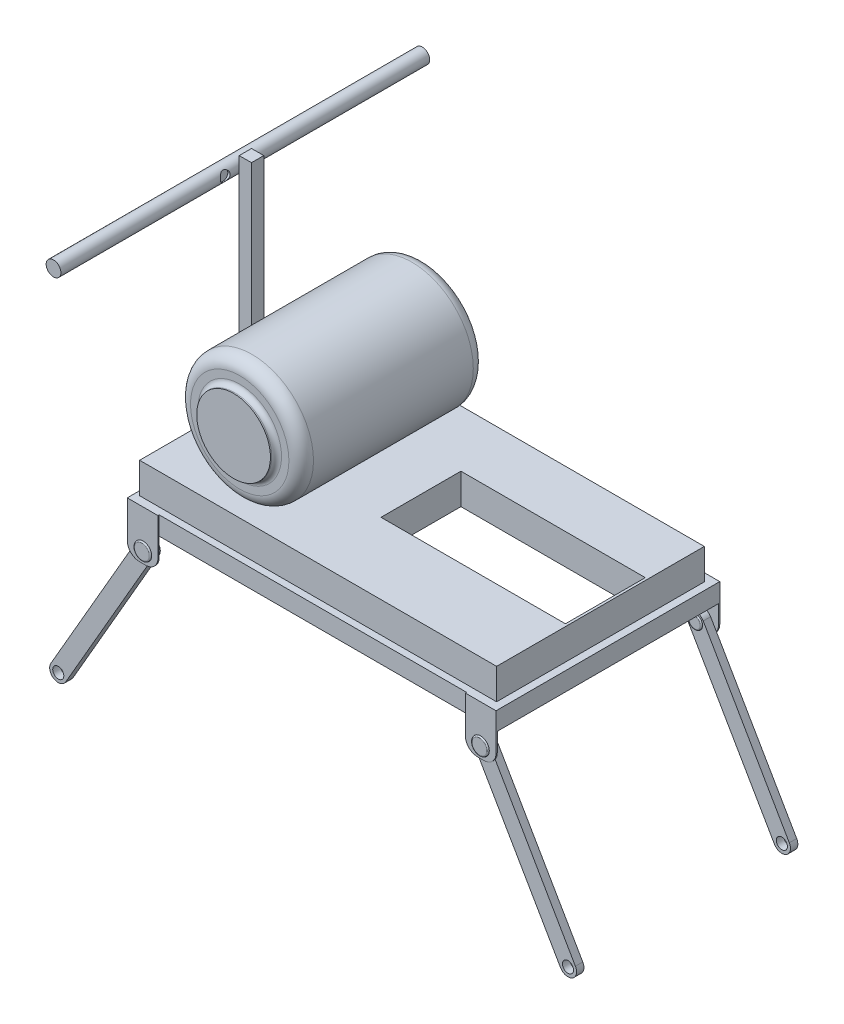
from build123d import *

# Parameters (mm, degrees)
SKETCH1_W                 = 300
SKETCH1_H                 = 15
BOSS_EXTRUDE1_DEPTH       = 180
SKETCH2_W                 = 276.393153848
SKETCH2_H                 = 159.056437592
CUT_EXTRUDE1_DEPTH        = 180
SKETCH3_W                 = 288.387573732
SKETCH3_H                 = 168.964871408
BOSS_EXTRUDE2_DEPTH       = 25
BOSS_EXTRUDE3_DEPTH       = 1
BOSS_EXTRUDE4_START       = 1
BOSS_EXTRUDE4_DEPTH       = 1
SKETCH6_R                 = 5
CUT_EXTRUDE2_DEPTH        = 200
SKETCH7_R                 = 4.8
SKETCH7_R_2               = 4.5
BOSS_EXTRUDE5_DEPTH       = 6
BOSS_EXTRUDE6_START       = 6
SKETCH8_R                 = 4.5
BOSS_EXTRUDE6_DEPTH       = 6
BOSS_EXTRUDE13_START      = 1
SKETCH15_R                = 7
BOSS_EXTRUDE13_DEPTH      = 1
FILLET2_R                 = 1
FILLET3_R                 = 1
SKETCH16_R                = 7.5
BOSS_EXTRUDE14_DEPTH      = 1
FILLET4_R                 = 1
SKETCH17_R                = 5.5
BOSS_EXTRUDE15_DEPTH      = 1
FILLET5_R                 = 1
BOSS_EXTRUDE16_START      = 1
SKETCH18_R                = 5.5
BOSS_EXTRUDE16_DEPTH      = 1
FILLET6_R                 = 1
SKETCH25_W                = 168.964871408
SKETCH25_H                = 25
BOSS_EXTRUDE22_DEPTH      = 2
SKETCH28_W                = 10
SKETCH28_H                = 10
BOSS_EXTRUDE25_DEPTH      = 175
BOSS_EXTRUDE26_DEPTH      = 145
BOSS_EXTRUDE26_DEPTH_BACK = 155
SKETCH30_R                = 6
SKETCH31_R                = 2
CUT_EXTRUDE3_DEPTH        = 15
SKETCH32_R                = 4
CUT_EXTRUDE4_DEPTH        = 2
SKETCH33_W                = 17.452069939
SKETCH33_H                = 31.073197695
BOSS_EXTRUDE27_DEPTH      = 15
FILLET7_R                 = 5
EXTRUDE_THIN3_DEPTH       = 5
EXTRUDE_THIN3_DEPTH_BACK  = 35
SKETCH34_R                = 2
SKETCH34_R_2              = 1.5
SKETCH35_W                = 2.832524323
SKETCH35_H                = 4.052008071
SKETCH35_R                = 0.8
SKETCH35_W_2              = 2.769934418
BOSS_EXTRUDE28_DEPTH      = 0.5
SKETCH36_R                = 1.5
BOSS_EXTRUDE29_DEPTH      = 14
SKETCH38_R                = 50
BOSS_EXTRUDE31_DEPTH      = 150
SKETCH39_R                = 30
BOSS_EXTRUDE32_DEPTH      = 5
BOSS_EXTRUDE33_START      = 5
SKETCH40_R                = 30
BOSS_EXTRUDE33_DEPTH      = 5
FILLET8_R                 = 10
FILLET9_R                 = 4
SKETCH41_W                = 150
SKETCH41_H                = 65
CUT_EXTRUDE5_DEPTH        = 40


with BuildPart() as part:
    # Sketch1 → Boss-Extrude1 (new body)
    with BuildSketch(Plane.XY):
        with Locations((48.043406306, 18.498679245)):
            Rectangle(SKETCH1_W, SKETCH1_H)
    extrude(amount=-BOSS_EXTRUDE1_DEPTH)

    # Sketch2 → Cut-Extrude1 (cut)
    with BuildSketch(Plane(origin=(0, 25.998679245, 0), x_dir=(1, 0, 0), z_dir=(0, 1, 0))):
        with Locations((47.521909789, 90.260748258)):
            Rectangle(SKETCH2_W, SKETCH2_H)
    extrude(amount=-CUT_EXTRUDE1_DEPTH, mode=Mode.SUBTRACT)

    # Sketch3 → Boss-Extrude2 (add)
    with BuildSketch(Plane(origin=(0, 25.998679245, 0), x_dir=(1, 0, 0), z_dir=(0, 1, 0))):
        with Locations((47.782658048, 90)):
            Rectangle(SKETCH3_W, SKETCH3_H)
    extrude(amount=BOSS_EXTRUDE2_DEPTH)

    # Sketch4 → Boss-Extrude3 (add)
    with BuildSketch(Plane.XY):
        with BuildLine():
            Line((173.043406306, 25.998679245), (173.043406306, -4.001320755))
            ThreePointArc((173.043406306, -4.001320755), (175.972338494, -11.072388567), (183.043406306, -14.001320755))
            Line((183.043406306, -14.001320755), (188.043406306, -14.001320755))
            ThreePointArc((188.043406306, -14.001320755), (195.114474118, -11.072388567), (198.043406306, -4.001320755))
            Line((198.043406306, -4.001320755), (198.043406306, 25.998679245))
            Line((198.043406306, 25.998679245), (173.043406306, 25.998679245))
        make_face()
        with BuildLine():
            Line((-101.956593694, 25.998679245), (-76.956593694, 25.998679245))
            Line((-76.956593694, 25.998679245), (-76.956593694, -4.001320755))
            ThreePointArc((-76.956593694, -4.001320755), (-79.885525882, -11.072388567), (-86.956593694, -14.001320755))
            Line((-86.956593694, -14.001320755), (-91.956593694, -14.001320755))
            ThreePointArc((-91.956593694, -14.001320755), (-99.027661506, -11.072388567), (-101.956593694, -4.001320755))
            Line((-101.956593694, -4.001320755), (-101.956593694, 25.998679245))
        make_face()
    extrude(amount=BOSS_EXTRUDE3_DEPTH)

    # Sketch5 → Boss-Extrude4 (add)
    with BuildSketch(Plane(origin=(0, 0, -180), x_dir=(-1, 0, 0), z_dir=(0, 0, -1)).offset(BOSS_EXTRUDE4_START)):
        with BuildLine():
            Line((-173.043406306, 25.998679245), (-173.043406306, -4.001320755))
            ThreePointArc((-173.043406306, -4.001320755), (-175.972338494, -11.072388567), (-183.043406306, -14.001320755))
            Line((-183.043406306, -14.001320755), (-188.043406306, -14.001320755))
            ThreePointArc((-188.043406306, -14.001320755), (-195.114474118, -11.072388567), (-198.043406306, -4.001320755))
            Line((-198.043406306, -4.001320755), (-198.043406306, 25.998679245))
            Line((-198.043406306, 25.998679245), (-173.043406306, 25.998679245))
        make_face()
        with BuildLine():
            Line((76.576694111, 26.008778741), (101.576694111, 26.008778741))
            Line((101.576694111, 26.008778741), (101.576694111, -3.991221259))
            ThreePointArc((101.576694111, -3.991221259), (98.647761923, -11.062289071), (91.576694111, -13.991221259))
            Line((91.576694111, -13.991221259), (86.576694111, -13.991221259))
            ThreePointArc((86.576694111, -13.991221259), (79.5056263, -11.062289071), (76.576694111, -3.991221259))
            Line((76.576694111, -3.991221259), (76.576694111, 26.008778741))
        make_face()
    extrude(amount=-BOSS_EXTRUDE4_DEPTH)

    # Sketch6 → Cut-Extrude2 (cut)
    with BuildSketch(Plane.XY.offset(1)):
        with Locations(Location((-89.076694111, -4.970985928, 0), (0, 0, 180))):
            Circle(SKETCH6_R)
        with Locations((185.543406306, -4.970985928)):
            Circle(SKETCH6_R)
    extrude(amount=-CUT_EXTRUDE2_DEPTH, mode=Mode.SUBTRACT)

    # Sketch7 → Boss-Extrude5 (add)
    # profile 1 of 2: a face of its own
    with BuildSketch(Plane(origin=(0, 0, 0), x_dir=(-1, 0, 0), z_dir=(0, 0, -1))):
        with BuildLine():
            Line((-179.48122848, -8.470985928), (-249.48122848, -129.714542458))
            ThreePointArc((-249.48122848, -129.714542458), (-259.043406306, -132.276720284), (-261.605584133, -122.714542458))
            Line((-261.605584133, -122.714542458), (-191.605584133, -1.470985928))
            ThreePointArc((-191.605584133, -1.470985928), (-182.043406306, 1.091191899), (-179.48122848, -8.470985928))
        make_face()
        with Locations((-185.543406306, -4.970985928)):
            Circle(SKETCH7_R, mode=Mode.SUBTRACT)
        with Locations((-255.543406306, -126.214542458)):
            Circle(SKETCH7_R_2, mode=Mode.SUBTRACT)
    # profile 2 of 2: a face of its own
    with BuildSketch(Plane(origin=(0, 0, 0), x_dir=(-1, 0, 0), z_dir=(0, 0, -1))):
        with BuildLine():
            Line((95.138871938, -1.470985928), (165.138871938, -122.714542458))
            ThreePointArc((165.138871938, -122.714542458), (162.576694111, -132.276720284), (153.014516285, -129.714542458))
            Line((153.014516285, -129.714542458), (83.014516285, -8.470985928))
            ThreePointArc((83.014516285, -8.470985928), (85.576694111, 1.091191899), (95.138871938, -1.470985928))
        make_face()
        with Locations((89.076694111, -4.970985928)):
            Circle(SKETCH7_R_2, mode=Mode.SUBTRACT)
        with Locations((159.076694111, -126.214542458)):
            Circle(SKETCH7_R_2, mode=Mode.SUBTRACT)
    extrude(amount=BOSS_EXTRUDE5_DEPTH)

    # Sketch8 → Boss-Extrude6 (add)
    # profile 1 of 2: a face of its own
    with BuildSketch(Plane.XY.offset(-180).offset(BOSS_EXTRUDE6_START)):
        with BuildLine():
            Line((-83.014516285, -8.470985928), (-153.014516285, -129.714542458))
            ThreePointArc((-153.014516285, -129.714542458), (-162.576694111, -132.276720284), (-165.138871938, -122.714542458))
            Line((-165.138871938, -122.714542458), (-95.138871938, -1.470985928))
            ThreePointArc((-95.138871938, -1.470985928), (-85.576694111, 1.091191899), (-83.014516285, -8.470985928))
        make_face()
        with Locations(Location((-89.076694111, -4.970985928, 0), (0, 0, 180))):
            Circle(SKETCH8_R, mode=Mode.SUBTRACT)
        with Locations(Location((-159.076694111, -126.214542458, 0), (0, 0, 180))):
            Circle(SKETCH8_R, mode=Mode.SUBTRACT)
    # profile 2 of 2: a face of its own
    with BuildSketch(Plane.XY.offset(-180).offset(BOSS_EXTRUDE6_START)):
        with BuildLine():
            Line((191.605584133, -1.470985928), (261.605584133, -122.714542458))
            ThreePointArc((261.605584133, -122.714542458), (259.043406306, -132.276720284), (249.48122848, -129.714542458))
            Line((249.48122848, -129.714542458), (179.48122848, -8.470985928))
            ThreePointArc((179.48122848, -8.470985928), (182.043406306, 1.091191899), (191.605584133, -1.470985928))
        make_face()
        with Locations((185.543406306, -4.970985928)):
            Circle(SKETCH8_R, mode=Mode.SUBTRACT)
        with Locations(Location((255.543406306, -126.214542458, 0), (0, 0, 180))):
            Circle(SKETCH8_R, mode=Mode.SUBTRACT)
    extrude(amount=-BOSS_EXTRUDE6_DEPTH)

    # Sketch15 → Boss-Extrude13 (add)
    with BuildSketch(Plane.XY.offset(1).offset(BOSS_EXTRUDE13_START)):
        with Locations(Location((185.543406306, -4.970985928, 0), (0, 0, 180))):
            Circle(SKETCH15_R)
        with Locations(Location((-89.076694111, -4.970985928, 0), (0, 0, 180))):
            Circle(SKETCH15_R)
    extrude(amount=-BOSS_EXTRUDE13_DEPTH)

    # Fillet2
    fillet2_edges = [part.edges().sort_by_distance(p)[0] for p in [
        (-82.076694111, -4.970985928, 2),
    ]]
    fillet(fillet2_edges, radius=FILLET2_R - 0.0001)  # a hair under: the kernel refuses the full size

    # Fillet3
    fillet3_edges = [part.edges().sort_by_distance(p)[0] for p in [
        (192.543406306, -4.970985928, 2),
    ]]
    fillet(fillet3_edges, radius=FILLET3_R - 0.0001)  # a hair under: the kernel refuses the full size

    # Sketch16 → Boss-Extrude14 (add)
    with BuildSketch(Plane(origin=(0, 0, -181), x_dir=(-1, 0, 0), z_dir=(0, 0, -1))):
        with Locations(Location((-185.543406306, -4.970985928, 0), (0, 0, 180))):
            Circle(SKETCH16_R)
        with Locations((89.076694111, -4.970985928)):
            Circle(SKETCH16_R)
    extrude(amount=BOSS_EXTRUDE14_DEPTH)

    # Fillet4
    fillet4_edges = [part.edges().sort_by_distance(p)[0] for p in [
        (178.043406306, -4.970985928, -182),
        (-81.576694111, -4.970985928, -182),
    ]]
    fillet(fillet4_edges, radius=FILLET4_R - 0.0001)  # a hair under: the kernel refuses the full size

    # Sketch17 → Boss-Extrude15 (add)
    with BuildSketch(Plane(origin=(0, 0, -6), x_dir=(-1, 0, 0), z_dir=(0, 0, -1))):
        with Locations((89.076694111, -4.970985928)):
            Circle(SKETCH17_R)
        with Locations((-185.543406306, -4.970985928)):
            Circle(SKETCH17_R)
    extrude(amount=BOSS_EXTRUDE15_DEPTH)

    # Fillet5
    fillet5_edges = [part.edges().sort_by_distance(p)[0] for p in [
        (-83.576694111, -4.970985928, -7),
        (191.043406306, -4.970985928, -7),
    ]]
    fillet(fillet5_edges, radius=FILLET5_R - 0.0001)  # a hair under: the kernel refuses the full size

    # Sketch18 → Boss-Extrude16 (add)
    with BuildSketch(Plane.XY.offset(-174).offset(BOSS_EXTRUDE16_START)):
        with Locations((-89.076694111, -4.970985928)):
            Circle(SKETCH18_R)
        with Locations((185.543406306, -4.970985928)):
            Circle(SKETCH18_R)
    extrude(amount=-BOSS_EXTRUDE16_DEPTH)

    # Fillet6
    fillet6_edges = [part.edges().sort_by_distance(p)[0] for p in [
        (-94.576694111, -4.970985928, -173),
        (180.043406306, -4.970985928, -173),
    ]]
    fillet(fillet6_edges, radius=FILLET6_R - 0.0001)  # a hair under: the kernel refuses the full size

    # Sketch25 → Boss-Extrude22 (add)
    with BuildSketch(Plane.ZY.offset(96.411128818)):
        with Locations((-90, 38.498679245)):
            Rectangle(SKETCH25_W, SKETCH25_H)
    extrude(amount=BOSS_EXTRUDE22_DEPTH)

    # Sketch28 → Boss-Extrude25 (add)
    with BuildSketch(Plane(origin=(0, 50.998679245, 0), x_dir=(1, 0, 0), z_dir=(0, 1, 0))):
        with Locations((-92.543760507, 90.645822389)):
            Rectangle(SKETCH28_W, SKETCH28_H)
    extrude(amount=BOSS_EXTRUDE25_DEPTH)

    # Sketch33 → Boss-Extrude27 (add)
    with BuildSketch(Plane(origin=(0, 50.998679245, 0), x_dir=(1, 0, 0), z_dir=(0, 1, 0))):
        with Locations((-65.851801155, 88.460322609)):
            Rectangle(SKETCH33_W, SKETCH33_H)
    extrude(amount=BOSS_EXTRUDE27_DEPTH)

    # Fillet7
    fillet7_edges = [part.edges().sort_by_distance(p)[0] for p in [
        (-74.577836125, 65.998679245, -88.460322609),
        (-57.125766186, 65.998679245, -88.460322609),
    ]]
    fillet(fillet7_edges, radius=FILLET7_R)

    # Sketch34 → Extrude-Thin3 (add, two sides: drawn at the far end of the back side and taken through both)
    with BuildSketch(Plane.XY.offset(-72.923723761).offset(-EXTRUDE_THIN3_DEPTH_BACK)):
        with Locations((-66.560672874, 58.138888935)):
            Circle(SKETCH34_R)
        with Locations((-66.560672874, 58.138888935)):
            Circle(SKETCH34_R_2, mode=Mode.SUBTRACT)
    extrude(amount=EXTRUDE_THIN3_DEPTH + EXTRUDE_THIN3_DEPTH_BACK)

    # Sketch35 → Boss-Extrude28 (add)
    # profile 1 of 2: a face of its own
    with BuildSketch(Plane(origin=(0, 50.998679245, 0), x_dir=(1, 0, 0), z_dir=(0, 1, 0))):
        with Locations((-55.709504025, 88.859268641)):
            Rectangle(SKETCH35_W, SKETCH35_H)
        with Locations(Location((-55.688341255, 88.859268641, 0), (0, 0, 270))):
            Circle(SKETCH35_R, mode=Mode.SUBTRACT)
    # profile 2 of 2: a face of its own
    with BuildSketch(Plane(origin=(0, 50.998679245, 0), x_dir=(1, 0, 0), z_dir=(0, 1, 0))):
        with Locations((-75.962803334, 88.859268641)):
            Rectangle(SKETCH35_W_2, SKETCH35_H)
        with Locations(Location((-75.962803334, 88.859268641, 0), (0, 0, 270))):
            Circle(SKETCH35_R, mode=Mode.SUBTRACT)
    extrude(amount=BOSS_EXTRUDE28_DEPTH)

    # Sketch36 → Boss-Extrude29 (add)
    with BuildSketch(Plane(origin=(-87.543760507, 0, 0), x_dir=(0, 0, -1), z_dir=(1, 0, 0))):
        with Locations(Location((90.398996209, 55.28829075, 0), (0, 0, 180))):
            Circle(SKETCH36_R)
    extrude(amount=BOSS_EXTRUDE29_DEPTH)

    # Sketch38 → Boss-Extrude31 (add)
    with BuildSketch(Plane.XY.offset(-15.517564296)):
        with Locations((-26.977315143, 101.321710991)):
            Circle(SKETCH38_R)
    extrude(amount=-BOSS_EXTRUDE31_DEPTH)

    # Sketch39 → Boss-Extrude32 (add)
    with BuildSketch(Plane.XY.offset(-15.517564296)):
        with Locations((-26.977315143, 101.321710991)):
            Circle(SKETCH39_R)
    extrude(amount=BOSS_EXTRUDE32_DEPTH)

    # Sketch40 → Boss-Extrude33 (add)
    with BuildSketch(Plane(origin=(0, 0, -165.517564296), x_dir=(-1, 0, 0), z_dir=(0, 0, -1)).offset(BOSS_EXTRUDE33_START)):
        with Locations(Location((26.977315143, 101.321710991, 0), (0, 0, 180))):
            Circle(SKETCH40_R)
    extrude(amount=-BOSS_EXTRUDE33_DEPTH)

    # Fillet8
    fillet8_edges = [part.edges().sort_by_distance(p)[0] for p in [
        (-76.977315143, 101.321710991, -165.517564296),
        (-76.977315143, 101.321710991, -15.517564296),
    ]]
    fillet(fillet8_edges, radius=FILLET8_R)

    # Fillet9
    fillet9_edges = [part.edges().sort_by_distance(p)[0] for p in [
        (-56.977315143, 101.321710991, -15.517564296),
        (-56.977315143, 101.321710991, -170.517564296),
    ]]
    fillet(fillet9_edges, radius=FILLET9_R)

    # Sketch41 → Cut-Extrude5 (cut)
    with BuildSketch(Plane(origin=(0, 50.998679245, 0), x_dir=(1, 0, 0), z_dir=(0, 1, 0))):
        with Locations((114.980302076, 95.995198142)):
            Rectangle(SKETCH41_W, SKETCH41_H)
    extrude(amount=-CUT_EXTRUDE5_DEPTH, mode=Mode.SUBTRACT)


with BuildPart() as body_2:
    # Sketch30 → Boss-Extrude26 (new, two sides: drawn at the far end of the back side and taken through both)
    with BuildSketch(Plane.XY.offset(-85.645822389).offset(-BOSS_EXTRUDE26_DEPTH_BACK)):
        with Locations((-103.566965113, 215.984859976)):
            Circle(SKETCH30_R)
    extrude(amount=BOSS_EXTRUDE26_DEPTH + BOSS_EXTRUDE26_DEPTH_BACK)

    # Sketch31 → Cut-Extrude3 (cut)
    with BuildSketch(Plane.ZY.offset(98.411128818)):
        with Locations(Location((-227.794864877, 216.33531912, 0), (0, 0, 180))):
            Circle(SKETCH31_R)
        with Locations(Location((-204.840671205, 216.33531912, 0), (0, 0, 180))):
            Circle(SKETCH31_R)
        with Locations(Location((48.114543058, 216.33531912, 0), (0, 0, 180))):
            Circle(SKETCH31_R)
        with Locations(Location((25.61943326, 216.33531912, 0), (0, 0, 180))):
            Circle(SKETCH31_R)
    extrude(amount=CUT_EXTRUDE3_DEPTH, mode=Mode.SUBTRACT)

    # Sketch32 → Cut-Extrude4 (cut)
    with BuildSketch(Plane.ZY.offset(97.543760507)):
        with Locations((-74.384490534, 216.521958473)):
            Circle(SKETCH32_R)
    extrude(amount=CUT_EXTRUDE4_DEPTH, mode=Mode.SUBTRACT)


solid = Compound([part.part, body_2.part])
